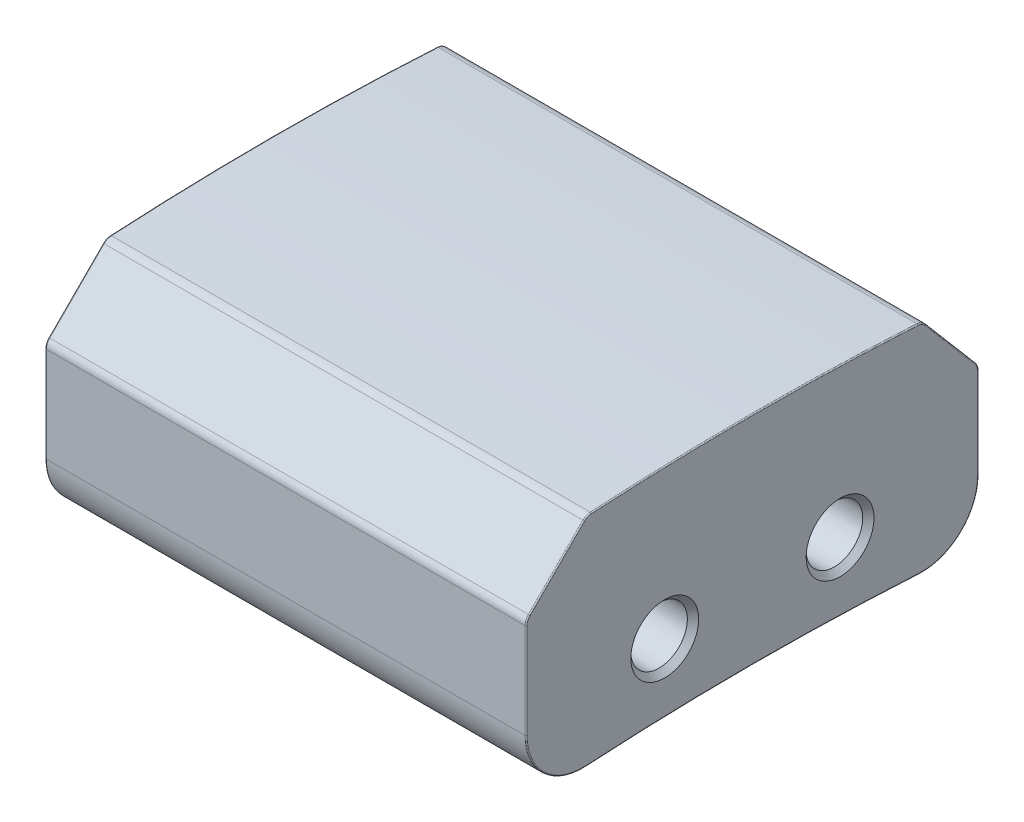
from build123d import *

# Parameters (mm, degrees)
SKETCH1_W           = 8.5
SKETCH1_H           = 8
BOSS_EXTRUDE1_DEPTH = 4.2
CUT_EXTRUDE1_DEPTH  = 14.2
CHAMFER1_SIZE       = 1.090756547
CHAMFER1_SIZE_2     = 1
FILLET1_R           = 1
FILLET2_R           = 0.2
FILLET3_R           = 0.02
SKETCH3_R           = 0.5
CUT_EXTRUDE2_DEPTH  = 14.2
CHAMFER2_SIZE       = 0.1


with BuildPart() as part:
    # Sketch1 → Boss-Extrude1 (new body)
    with BuildSketch(Plane(origin=(0, 0, 0), x_dir=(1, 0, 0), z_dir=(0, 1, 0))):
        Rectangle(SKETCH1_W, SKETCH1_H)
    extrude(amount=BOSS_EXTRUDE1_DEPTH)

    # Sketch2 → Cut-Extrude1 (cut)
    with BuildSketch(Plane(origin=(4.25, 0, 0), x_dir=(0, 0, -1), z_dir=(1, 0, 0))):
        with BuildLine():
            Line((-4, 3.9), (-5.253535024, 5.241651662))
            Line((-5.253535024, 5.241651662), (3.889156526, 7.141243929))
            Line((3.889156526, 7.141243929), (5.679183493, 5.077233243))
            Line((5.679183493, 5.077233243), (4, 3.9))
            ThreePointArc((4, 3.9), (0, 4.060256822), (-4, 3.9))
        make_face()
        with BuildLine():
            Line((4.717394395, 0), (0, -2.904825783))
            Line((0, -2.904825783), (-4.70037365, 0))
            ThreePointArc((-4.70037365, 0), (0.008510373, 0.222229748), (4.717394395, 0))
        make_face()
    extrude(amount=-CUT_EXTRUDE1_DEPTH, mode=Mode.SUBTRACT)

    # Chamfer1
    # the kernel refuses this chamfer: 1.090756547, 1 mm, written as the material it takes off along each edge
    with BuildSketch(Plane(origin=(7.060832105, 3.9, -4), x_dir=(0, -1, 0), z_dir=(-1, 0, 0))) as chamfer1_piece_1:
        with BuildLine():
            Line((CHAMFER1_SIZE, 0), (-0.069441157, 0.98780495))
            ThreePointArc((-0.069441157, 0.98780495), (-0.038234412, 0.508961249), (0, 0))
            Line((0, 0), (CHAMFER1_SIZE, 0))
        make_face()
    extrude(amount=14.12166421, mode=Mode.SUBTRACT)
    with BuildSketch(Plane(origin=(7.026184696, 3.9, 4), x_dir=(0, 0.06925797782051132, -0.9975987833333668), z_dir=(-1, 0, 0))) as chamfer1_piece_2:
        with BuildLine():
            Line((1.077190612, 0), (-CHAMFER1_SIZE_2 * 0.0692579778205, CHAMFER1_SIZE_2 * 0.997598783333))
            Line((-CHAMFER1_SIZE_2 * 0.0692579778205, CHAMFER1_SIZE_2 * 0.997598783333), (0, 0))
            ThreePointArc((0, 0), (0.555048482, -0.002898226), (1.077190612, 0))
        make_face()
    extrude(amount=14.052369392, mode=Mode.SUBTRACT)

    # Fillet1
    fillet1_edges = [part.edges().sort_by_distance(p)[0] for p in [
        (0, 0.062655213, -4),
        (0, 0.061289175, 4),
    ]]
    fillet(fillet1_edges, radius=FILLET1_R)

    # Fillet2
    fillet2_edges = [part.edges().sort_by_distance(p)[0] for p in [
        (0, 2.809243453, -4),
        (0, 3.974604043, 2.925395957),
        (0, 3.969441157, -3.01219505),
        (0, 2.9, 4),
    ]]
    fillet(fillet2_edges, radius=FILLET2_R)

    # Fillet3
    fillet3_edges = [part.edges().sort_by_distance(p)[0] for p in [
        (4.25, 0.222229049, -0.000152397),
        (4.25, 0.406869221, -3.686055151),
        (4.25, 0.405751593, 3.685933525),
        (-4.25, 0.222229049, -0.000152397),
        (-4.25, 0.406869221, -3.686055151),
        (-4.25, 0.405751593, 3.685933525),
        (4.25, 1.93502694, -4),
        (-4.25, 1.93502694, -4),
        (4.25, 1.975286544, 4),
        (4.25, 3.384901314, -3.509878633),
        (4.25, 4.060241686, -0.03890618),
        (4.25, 3.439667659, 3.460332341),
        (4.25, 2.893693974, 3.984775907),
        (4.25, 3.961854563, 2.919594368),
        (4.25, 3.953888859, -3.004346497),
        (4.25, 2.804713491, -3.987691713),
        (-4.25, 3.384901314, -3.509878633),
        (-4.25, 1.975286544, 4),
        (-4.25, 3.439667659, 3.460332341),
        (-4.25, 4.060241686, -0.03890618),
        (-4.25, 2.893693974, 3.984775907),
        (-4.25, 3.961854563, 2.919594368),
        (-4.25, 3.953888859, -3.004346497),
        (-4.25, 2.804713491, -3.987691713),
    ]]
    fillet(fillet3_edges, radius=FILLET3_R)

    # Sketch3 → Cut-Extrude2 (cut)
    with BuildSketch(Plane.ZY.offset(4.25)):
        with Locations((-1.55, 1.4)):
            Circle(SKETCH3_R)
        with Locations((1.55, 1.4)):
            Circle(SKETCH3_R)
    extrude(amount=-CUT_EXTRUDE2_DEPTH, mode=Mode.SUBTRACT)

    # Chamfer2
    chamfer2_edges = [part.edges().sort_by_distance(p)[0] for p in [
        (4.25, 1.4, -2.05),
        (-4.25, 1.4, -2.05),
        (4.25, 1.4, 1.05),
        (-4.25, 1.4, 1.05),
    ]]
    chamfer(chamfer2_edges, length=CHAMFER2_SIZE)


solid = part.part
